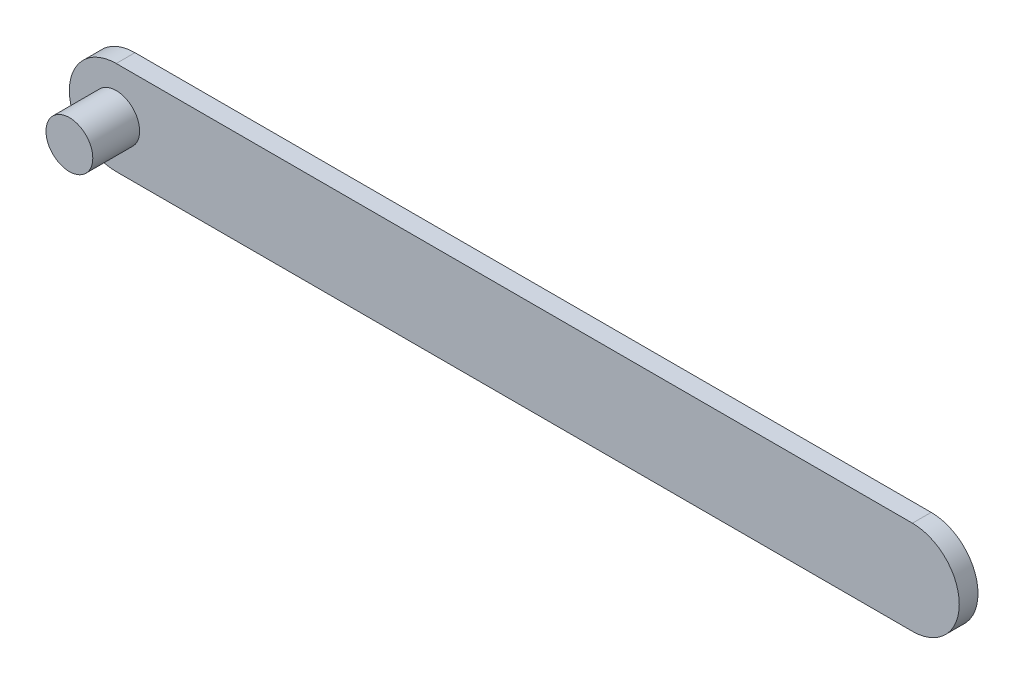
from build123d import *

# Parameters (mm, degrees)
BOSS_EXTRUDE1_DEPTH = 2
SKETCH2_R           = 2.5
BOSS_EXTRUDE2_DEPTH = 5


with BuildPart() as part:
    # Sketch1 → Boss-Extrude1 (new body)
    with BuildSketch(Plane.XY):
        with BuildLine():
            Line((0, 0), (85, 0))
            ThreePointArc((85, 0), (90, 5), (85, 10))
            Line((85, 10), (0, 10))
            ThreePointArc((0, 10), (-5, 5), (0, 0))
        make_face()
    extrude(amount=BOSS_EXTRUDE1_DEPTH)

    # Sketch2 → Boss-Extrude2 (add)
    with BuildSketch(Plane.XY.offset(2)):
        with Locations((0, 5)):
            Circle(SKETCH2_R)
    extrude(amount=BOSS_EXTRUDE2_DEPTH)


solid = part.part
